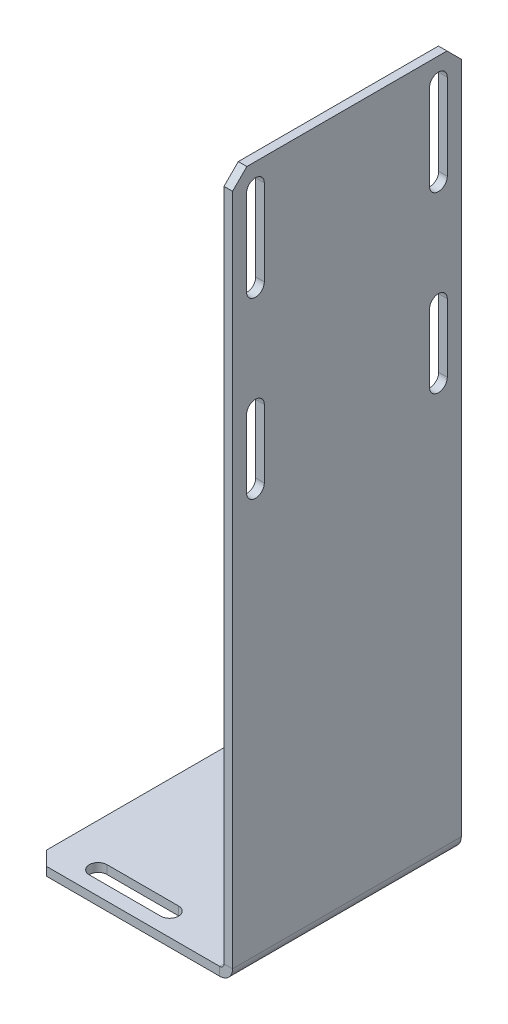
from build123d import *

# Parameters (mm, degrees)
SM_BASE_FLANGE_1_DEPTH      = 40
CHAMFER_1_SIZE              = 5
CUT_EXTRUDE_1_DEPTH         = 258.126428047
CUT_EXTRUDE_2_DEPTH         = 256.076459125
HOLE_START                  = -3
HOLE_WIZARD_6_2_6_2_1_DEPTH = 3


# Read off the part's stored shape, not the designer's step: Ø6.2 (6.2) 直径槽口1
# Sheet-metal steps are written as plain solids
with BuildPart() as part:
    # Sketch 2 → 基体-法兰1 (new, symmetric)
    with BuildSketch(Plane.XY):
        with BuildLine():
            Line((0, 245), (0, 4.5))
            ThreePointArc((0, 4.5), (-1.318019485, 1.318019485), (-4.5, 0))
            Line((-4.5, 0), (-70, 0))
            Line((-70, 0), (-70, 3))
            Line((-70, 3), (-4.5, 3))
            ThreePointArc((-4.5, 3), (-3.439339828, 3.439339828), (-3, 4.5))
            Line((-3, 4.5), (-3, 245))
            Line((-3, 245), (0, 245))
        make_face()
    extrude(amount=SM_BASE_FLANGE_1_DEPTH, both=True)

    # 倒角1
    chamfer_1_edges = [part.edges().sort_by_distance(p)[0] for p in [
        (-1.5, 245, 40),
        (-70, 1.5, 40),
        (-1.5, 245, -40),
        (-70, 1.5, -40),
    ]]
    chamfer(chamfer_1_edges, length=CHAMFER_1_SIZE)

    # 草图7 → 切除-拉伸1 (cut, through all)
    with BuildSketch(Plane.ZY.offset(3)):
        with BuildLine():
            Line((-28.9, 237), (-28.9, 207))
            ThreePointArc((-28.9, 207), (-32, 203.9), (-35.1, 207))
            Line((-35.1, 207), (-35.1, 237))
            ThreePointArc((-35.1, 237), (-32, 240.1), (-28.9, 237))
        make_face()
    cut_extrude_1 = extrude(amount=-CUT_EXTRUDE_1_DEPTH, mode=Mode.SUBTRACT)

    # 草图10 → 切除-拉伸2 (cut, through all)
    with BuildSketch(Plane(origin=(0, 3, 0), x_dir=(1, 0, 0), z_dir=(0, 1, 0))):
        with BuildLine():
            Line((-55, 35.1), (-30, 35.1))
            ThreePointArc((-30, 35.1), (-26.9, 32), (-30, 28.9))
            Line((-30, 28.9), (-55, 28.9))
            ThreePointArc((-55, 28.9), (-58.1, 32), (-55, 35.1))
        make_face()
    cut_extrude_2 = extrude(amount=-CUT_EXTRUDE_2_DEPTH, mode=Mode.SUBTRACT)

    # 镜向1: 切除-拉伸1, 切除-拉伸2 across plane
    add(cut_extrude_1.mirror(Plane.XY), mode=Mode.SUBTRACT)
    add(cut_extrude_2.mirror(Plane.XY), mode=Mode.SUBTRACT)

    # Ø6.2 (6.2) 直径槽口1 outline → Ø6.2 (6.2) 直径槽口1 (cut)
    with BuildSketch(Plane.YZ.offset(HOLE_START)):
        with BuildLine():
            ThreePointArc((169.9, -35.1), (173, -32), (169.9, -28.9))
            Line((169.9, -28.9), (146.1, -28.9))
            ThreePointArc((146.1, -28.9), (143, -32), (146.1, -35.1))
            Line((146.1, -35.1), (169.9, -35.1))
        make_face()
        with BuildLine():
            ThreePointArc((169.9, 28.9), (173, 32), (169.9, 35.1))
            Line((169.9, 35.1), (146.1, 35.1))
            ThreePointArc((146.1, 35.1), (143, 32), (146.1, 28.9))
            Line((146.1, 28.9), (169.9, 28.9))
        make_face()
    extrude(amount=HOLE_WIZARD_6_2_6_2_1_DEPTH, mode=Mode.SUBTRACT)


solid = part.part
